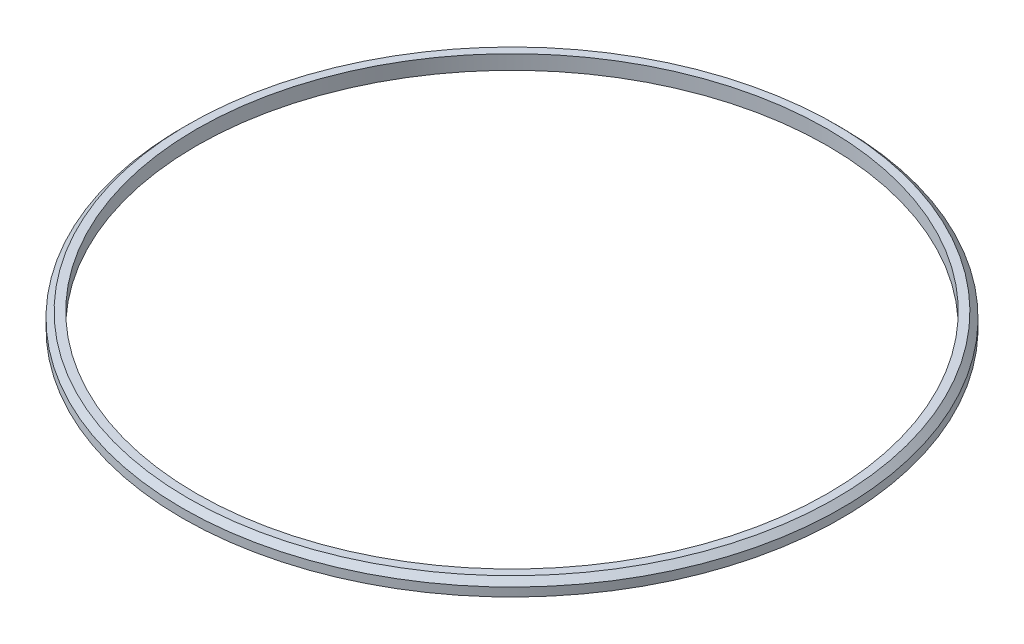
from build123d import *

# Parameters (mm, degrees)
SKETCH1_R           = 57.2125
SKETCH1_R_2         = 54.7875
BOSS_EXTRUDE1_DEPTH = 2.5
CHAMFER1_SIZE       = 1


with BuildPart() as part:
    # Sketch1 → Boss-Extrude1 (new body)
    with BuildSketch(Plane(origin=(0, 0, 0), x_dir=(1, 0, 0), z_dir=(0, 1, 0))):
        Circle(SKETCH1_R)
        Circle(SKETCH1_R_2, mode=Mode.SUBTRACT)
    extrude(amount=BOSS_EXTRUDE1_DEPTH)

    # Chamfer1
    chamfer1_edges = [part.edges().sort_by_distance(p)[0] for p in [
        (-57.2125, 2.5, 0),
    ]]
    chamfer(chamfer1_edges, length=CHAMFER1_SIZE)


solid = part.part
